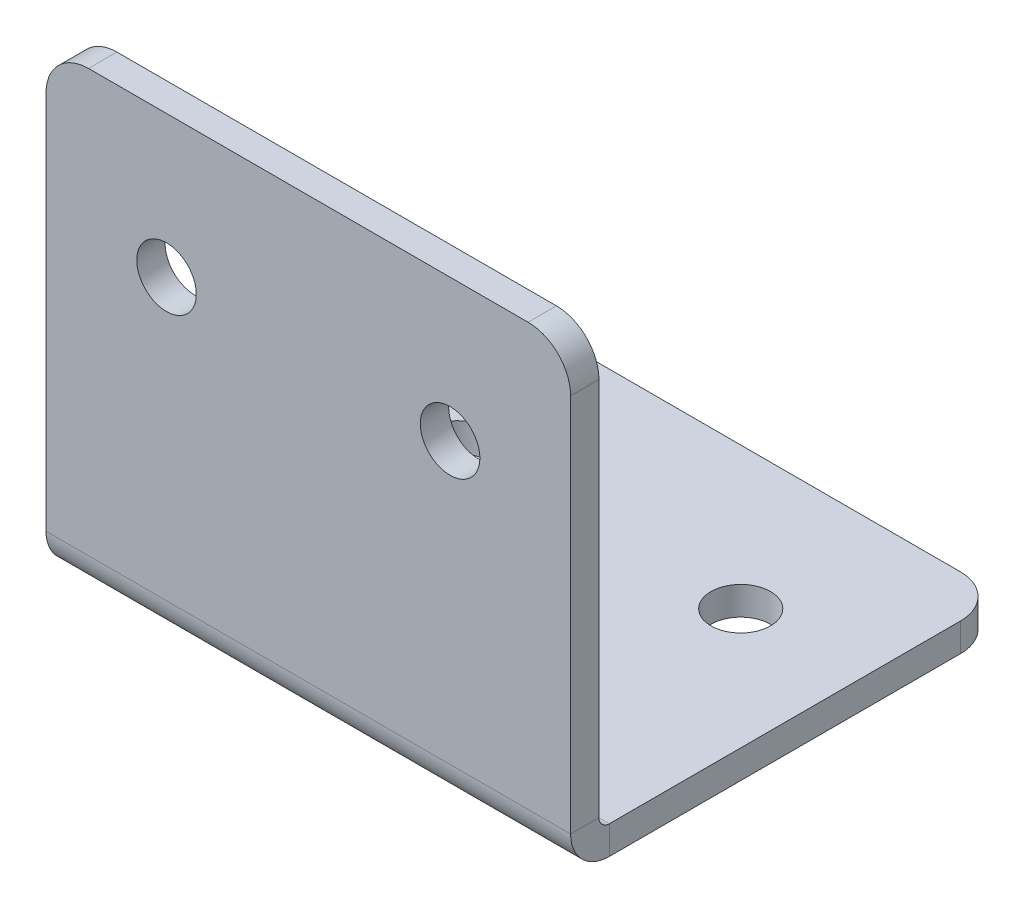
from build123d import *

# Parameters (mm, degrees)
SKETCH_1_R                       = 2.1
SM_BASE_FLANGE_1_DEPTH           = 2
SM_EDGE_FLANGE_1_STRIP_W         = 9.4732
SM_EDGE_FLANGE_1_STRIP_H         = 2
SM_EDGE_FLANGE_1_STRIP_CUT_DEPTH = 37
SM_EDGE_FLANGE_1_DEPTH           = 37
SM_EDGE_FLANGE_1_PROFILE_R       = 2.1
SM_EDGE_FLANGE_1_FLAT_DEPTH      = 2


# Sheet-metal steps are written as plain solids
with BuildPart() as part:
    # Sketch 1 → 基体-法兰1 (new body)
    with BuildSketch(Plane(origin=(0, 0, 0), x_dir=(1, 0, 0), z_dir=(0, 1, 0))):
        with BuildLine():
            Line((-15.5, 16.75), (15.5, 16.75))
            ThreePointArc((15.5, 16.75), (17.621320344, 15.871320344), (18.5, 13.75))
            Line((18.5, 13.75), (18.5, -13.75))
            Line((18.5, -13.75), (-18.5, -13.75))
            Line((-18.5, -13.75), (-18.5, 13.75))
            ThreePointArc((-18.5, 13.75), (-17.621320344, 15.871320344), (-15.5, 16.75))
        make_face()
        with Locations(Location((-10, 6.75, 0), (0, 0, 270))):
            Circle(SKETCH_1_R, mode=Mode.SUBTRACT)
        with Locations(Location((10, 6.75, 0), (0, 0, 90))):
            Circle(SKETCH_1_R, mode=Mode.SUBTRACT)
    extrude(amount=-SM_BASE_FLANGE_1_DEPTH)

    # 边线-法兰1 strip (across the edge) → 边线-法兰1 strip cut (cut)
    with BuildSketch(Plane(origin=(-18.5, 0, 13.75), x_dir=(0, 0, -1), z_dir=(1, 0, 0))):
        with Locations((-2, -1)):
            Rectangle(SM_EDGE_FLANGE_1_STRIP_W, SM_EDGE_FLANGE_1_STRIP_H)
    extrude(amount=SM_EDGE_FLANGE_1_STRIP_CUT_DEPTH, mode=Mode.SUBTRACT)

    # 边线-法兰1 bend section (across the edge) → 边线-法兰1 (add)
    with BuildSketch(Plane(origin=(-18.5, 0, 13.75), x_dir=(0, 0, -1), z_dir=(1, 0, 0))):
        with BuildLine():
            Line((0, 0.7366), (2, 0.7366))
            ThreePointArc((2, 0.7366), (2.215745145, 0.215745145), (2.7366, 0))
            Line((2.7366, 0), (2.7366, -2))
            ThreePointArc((2.7366, -2), (0.801531583, -1.198468417), (0, 0.7366))
        make_face()
    extrude(amount=SM_EDGE_FLANGE_1_DEPTH)

    # 边线-法兰1 profile (on flange) → 边线-法兰1 flat (add)
    with BuildSketch(Plane.XY.offset(13.75)):
        with BuildLine():
            Line((-18.5, 27.5), (-18.5, 0.7366))
            Line((-18.5, 0.7366), (18.5, 0.7366))
            Line((18.5, 0.7366), (18.5, 27.5))
            ThreePointArc((18.5, 27.5), (17.621320344, 29.621320344), (15.5, 30.5))
            Line((15.5, 30.5), (-15.5, 30.5))
            ThreePointArc((-15.5, 30.5), (-17.621320344, 29.621320344), (-18.5, 27.5))
        make_face()
        with Locations((-10, 20.5)):
            Circle(SM_EDGE_FLANGE_1_PROFILE_R, mode=Mode.SUBTRACT)
        with Locations((10, 20.5)):
            Circle(SM_EDGE_FLANGE_1_PROFILE_R, mode=Mode.SUBTRACT)
    extrude(amount=-SM_EDGE_FLANGE_1_FLAT_DEPTH)


solid = part.part
